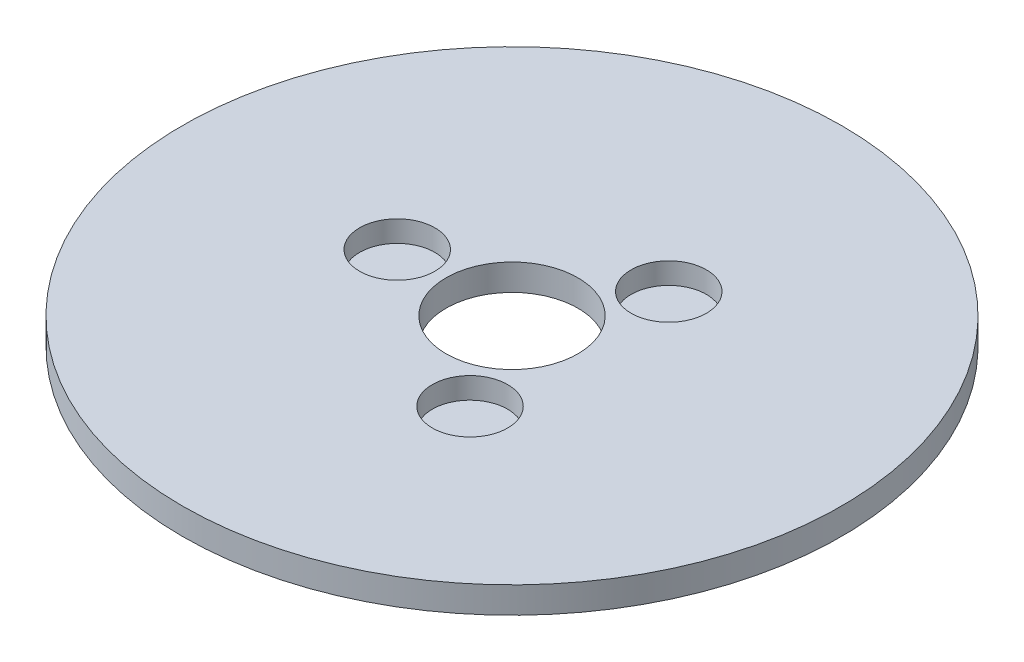
from build123d import *

# Parameters (mm, degrees)
SKETCH1_R           = 87.5
BOSS_EXTRUDE1_DEPTH = 7
SKETCH2_R           = 17.5
CUT_EXTRUDE1_DEPTH  = 124.941518467
SKETCH3_R           = 10
CUT_EXTRUDE2_DEPTH  = 5.660766818
CIRPATTERN1_COUNT   = 3


with BuildPart() as part:
    # Sketch1 → Boss-Extrude1 (new body)
    with BuildSketch(Plane(origin=(0, 0, 0), x_dir=(1, 0, 0), z_dir=(0, 1, 0))):
        Circle(SKETCH1_R)
    extrude(amount=BOSS_EXTRUDE1_DEPTH)

    # Sketch2 → Cut-Extrude1 (cut, through all)
    with BuildSketch(Plane(origin=(0, 0, 0), x_dir=(1, 0, 0), z_dir=(0, 1, 0))):
        Circle(SKETCH2_R)
    extrude(amount=CUT_EXTRUDE1_DEPTH, mode=Mode.SUBTRACT)

    # Sketch3 → Cut-Extrude2 (cut)
    with BuildSketch(Plane(origin=(0, 7, 0), x_dir=(1, 0, 0), z_dir=(0, 1, 0))):
        with Locations((-30.470107867, 0)):
            Circle(SKETCH3_R)
    cut_extrude2 = extrude(amount=-CUT_EXTRUDE2_DEPTH, mode=Mode.SUBTRACT)

    # CirPattern1: Cut-Extrude2 ×3 about axis
    cirpattern1_axis = Axis((0, 0, 0), (0, 1, 0))
    for i in range(1, CIRPATTERN1_COUNT):
        add(cut_extrude2.rotate(cirpattern1_axis, i * 360 / CIRPATTERN1_COUNT), mode=Mode.SUBTRACT)


solid = part.part
